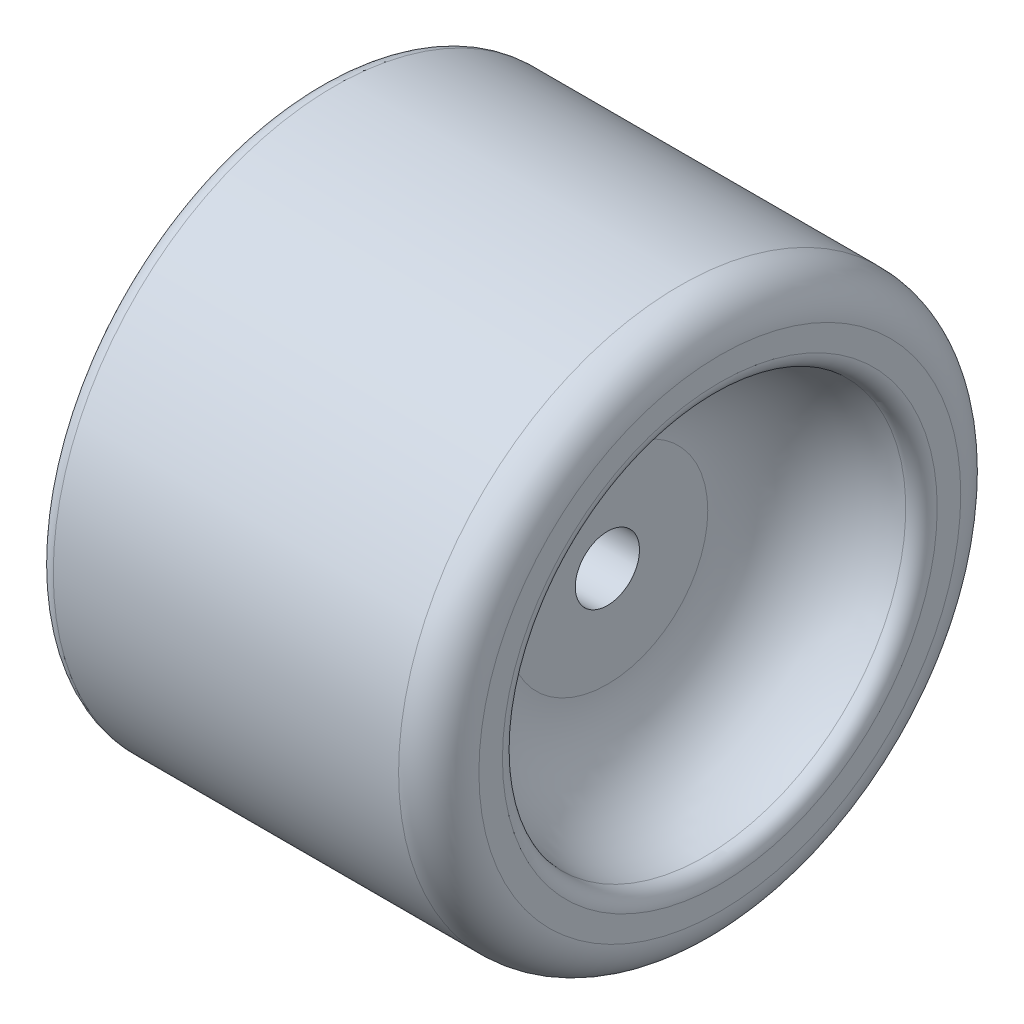
from build123d import *


with BuildPart() as part:
    # Sketch1 → Revolve1 (revolve)
    with BuildSketch(Plane(origin=(0, 0, 0), x_dir=(-1, 0, 0), z_dir=(0, 0, -1))):
        with BuildLine():
            Line((0, 4), (22, 4))
            Line((22, 4), (22, 12.5))
            Line((22, 12.5), (24.562401465, 12.5))
            ThreePointArc((24.562401465, 12.5), (24.889670699, 12.62198565), (25.057251332, 12.928420605))
            ThreePointArc((25.057251332, 12.928420605), (28.336858489, 21.346867264), (34.986476907, 27.463127736))
            ThreePointArc((34.986476907, 27.463127736), (35.728142618, 28.19617719), (36, 29.20291603))
            Line((36, 29.20291603), (36, 33))
            ThreePointArc((36, 33), (35.414213562, 34.414213562), (34, 35))
            Line((34, 35), (-9, 35))
            ThreePointArc((-9, 35), (-12.535533906, 33.535533906), (-14, 30))
            Line((-14, 30), (-14, 27.068802284))
            ThreePointArc((-14, 27.068802284), (-13.442084631, 25.683020225), (-12.079608083, 25.070387274))
            ThreePointArc((-12.079608083, 25.070387274), (-3.509387298, 21.216816616), (0, 12.5))
            Line((0, 12.5), (0, 4))
        make_face()
    revolve(axis=Axis((14.002105865, 0, 0), (-1, 0, 0)))


solid = part.part
